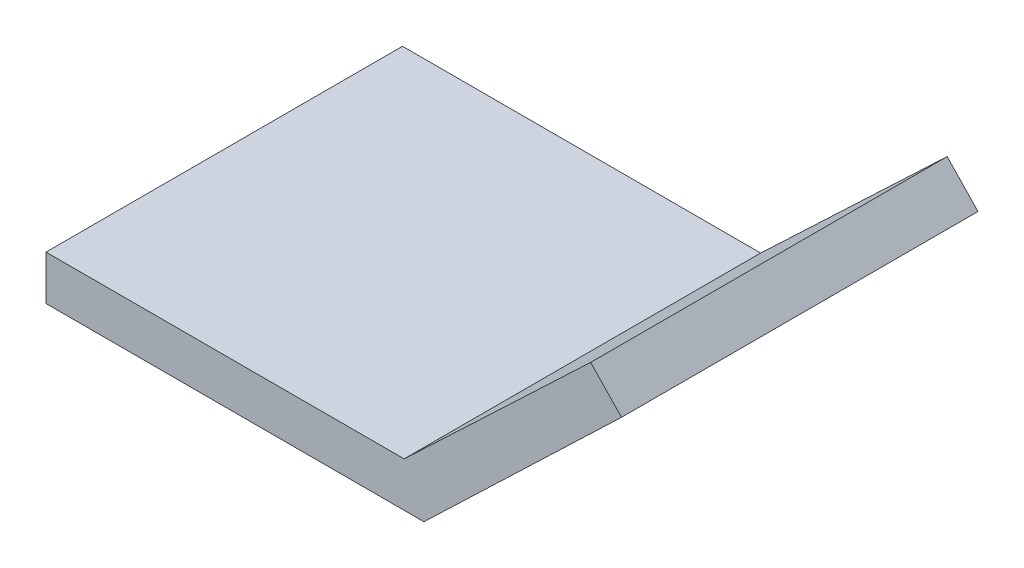
from build123d import *

# Parameters (mm, degrees)
BOSS_EXTRUDE1_DEPTH = 25.4


with BuildPart() as part:
    # Sketch1 → Boss-Extrude1 (new body)
    with BuildSketch(Plane.XY):
        Polygon((0, 0), (-26.924, 0), (-26.924, 3.175), (-1.408040596, 3.175), (11.88156486, 15.773352763), (14.077453494, 13.480167619), align=None)
    extrude(amount=BOSS_EXTRUDE1_DEPTH)


solid = part.part
